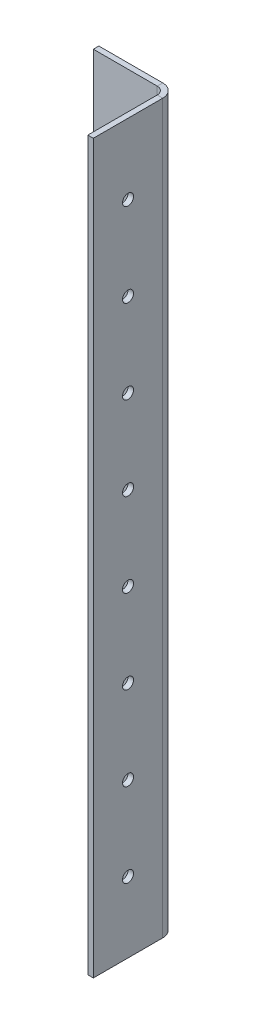
from build123d import *

# Parameters (mm, degrees)
SKETCH1_W                    = 140
SKETCH1_H                    = 1320
BASE_FLANGE1_DEPTH           = 10
EDGE_FLANGE1_STRIP_W         = 68
EDGE_FLANGE1_STRIP_H         = 10
EDGE_FLANGE1_STRIP_CUT_DEPTH = 1320
EDGE_FLANGE1_DEPTH           = 1320
SKETCH12_R                   = 10
CUT_EXTRUDE1_DEPTH           = 10
SKETCH13_R                   = 10
CUT_EXTRUDE2_DEPTH           = 10
LPATTERN1_COUNT              = 8
LPATTERN1_PITCH              = 152


# Sheet-metal steps are written as plain solids
with BuildPart() as part:
    # Sketch1 → Base-Flange1 (new body)
    with BuildSketch(Plane.XY):
        Rectangle(SKETCH1_W, SKETCH1_H)
    extrude(amount=-BASE_FLANGE1_DEPTH)

    # Edge-Flange1 strip (across the edge) → Edge-Flange1 strip cut (cut)
    with BuildSketch(Plane(origin=(70, -660, 0), x_dir=(-1, 0, 0), z_dir=(0, 1, 0))):
        with Locations((-10, -5)):
            Rectangle(EDGE_FLANGE1_STRIP_W, EDGE_FLANGE1_STRIP_H)
    extrude(amount=EDGE_FLANGE1_STRIP_CUT_DEPTH, mode=Mode.SUBTRACT)

    # Edge-Flange1 section (across the edge) → Edge-Flange1 (add)
    with BuildSketch(Plane(origin=(70, -660, 0), x_dir=(-1, 0, 0), z_dir=(0, 1, 0))):
        with BuildLine():
            Line((0, 14), (0, 140))
            Line((0, 140), (10, 140))
            Line((10, 140), (10, 14))
            ThreePointArc((10, 14), (14.100505063, 4.100505063), (24, 0))
            Line((24, 0), (24, -10))
            ThreePointArc((24, -10), (7.029437252, -2.970562748), (0, 14))
        make_face()
    extrude(amount=EDGE_FLANGE1_DEPTH)

    # Sketch12 → Cut-Extrude1 (cut)
    with BuildSketch(Plane.ZY.offset(-60)):
        with Locations((77, 532)):
            Circle(SKETCH12_R)
    cut_extrude1 = extrude(amount=-CUT_EXTRUDE1_DEPTH, mode=Mode.SUBTRACT)

    # Sketch13 → Cut-Extrude2 (cut)
    with BuildSketch(Plane.XY):
        with Locations((-7, 532)):
            Circle(SKETCH13_R)
    cut_extrude2 = extrude(amount=-CUT_EXTRUDE2_DEPTH, mode=Mode.SUBTRACT)

    # LPattern1: Cut-Extrude1, Cut-Extrude2 ×8
    with Locations(*[(0, -i * LPATTERN1_PITCH, 0) for i in range(1, LPATTERN1_COUNT)]):
        add(cut_extrude1, mode=Mode.SUBTRACT)
        add(cut_extrude2, mode=Mode.SUBTRACT)


solid = part.part
